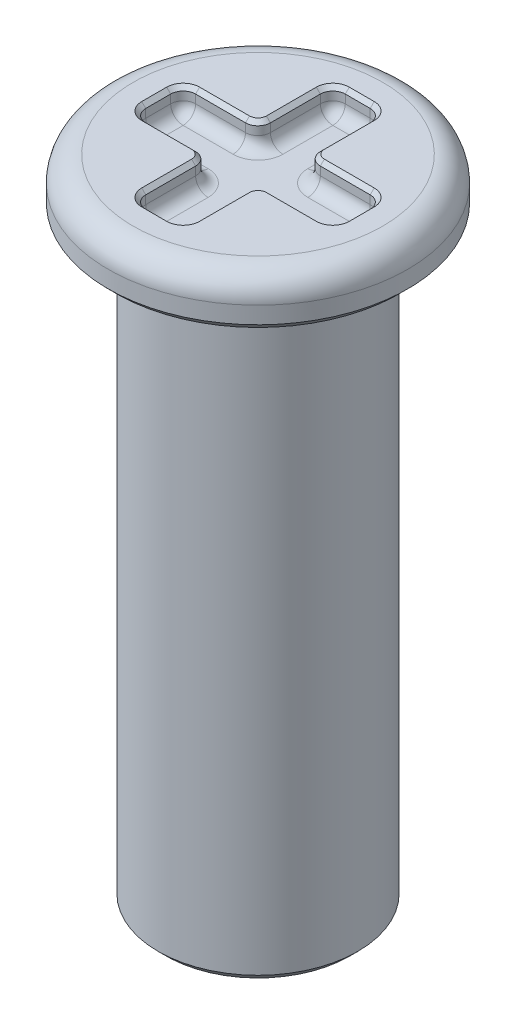
from build123d import *

# Parameters (mm, degrees)
CUT_EXTRUDE1_DEPTH = 0.79375
FILLET1_R          = 0.79375
FILLET2_R          = 0.396875
CHAMFER1_SIZE      = 0.254
CHAMFER2_SIZE      = 0.127


with BuildPart() as part:
    # Sketch1 → Revolve1 (revolve)
    with BuildSketch(Plane.XY):
        Polygon((2.38125, 0), (3.175, 0), (3.175, 19.05), (4.7625, 19.05), (4.7625, 20.6375), (0, 20.6375), (0, 19.05), (2.38125, 19.05), align=None)
    revolve(axis=Axis((0, 3.655427632, 0), (0, -1, 0)))

    # Sketch2 → Cut-Extrude1 (cut)
    with BuildSketch(Plane(origin=(0, 20.6375, 0), x_dir=(1, 0, 0), z_dir=(0, 1, 0))):
        Polygon((-3.175, 0.79375), (-3.175, -0.79375), (-0.79375, -0.79375), (-0.79375, -3.175), (0.79375, -3.175), (0.79375, -0.79375), (3.175, -0.79375), (3.175, 0.79375), (0.79375, 0.79375), (0.79375, 3.175), (-0.79375, 3.175), (-0.79375, 0.79375), align=None)
    extrude(amount=-CUT_EXTRUDE1_DEPTH, mode=Mode.SUBTRACT)

    # Fillet1
    fillet1_edges = [part.edges().sort_by_distance(p)[0] for p in [
        (-3.175, 19.05, 0),
        (-4.7625, 20.6375, 0),
    ]]
    fillet(fillet1_edges, radius=FILLET1_R)

    # Fillet2
    fillet2_edges = [part.edges().sort_by_distance(p)[0] for p in [
        (0, 19.84375, -3.175),
        (-0.79375, 19.84375, -1.984375),
        (-3.175, 19.84375, 0),
        (-1.984375, 19.84375, 0.79375),
        (-0.79375, 19.84375, 1.984375),
        (0, 19.84375, 3.175),
        (0.79375, 19.84375, 1.984375),
        (1.984375, 19.84375, 0.79375),
        (3.175, 19.84375, 0),
        (1.984375, 19.84375, -0.79375),
        (0.79375, 19.84375, -1.984375),
        (-0.79375, 20.240625, -3.175),
        (-0.79375, 20.240625, -0.79375),
        (-3.175, 20.240625, -0.79375),
        (-3.175, 20.240625, 0.79375),
        (-0.79375, 20.240625, 0.79375),
        (-0.79375, 20.240625, 3.175),
        (0.79375, 20.240625, 3.175),
        (0.79375, 20.240625, 0.79375),
        (3.175, 20.240625, 0.79375),
        (3.175, 20.240625, -0.79375),
        (0.79375, 20.240625, -0.79375),
        (0.79375, 20.240625, -3.175),
        (-1.984375, 19.84375, -0.79375),
        (-2.38125, 19.05, 0),
    ]]
    fillet(fillet2_edges, radius=FILLET2_R)

    # Chamfer1
    chamfer1_edges = [part.edges().sort_by_distance(p)[0] for p in [
        (-2.38125, 0, 0),
        (-3.175, 0, 0),
        (-4.7625, 19.05, 0),
    ]]
    chamfer(chamfer1_edges, length=CHAMFER1_SIZE)

    # Chamfer2
    chamfer2_edges = [part.edges().sort_by_distance(p)[0] for p in [
        (-1.984375, 20.6375, -0.79375),
        (-3.058758004, 20.6375, -0.677508004),
        (-0.909991996, 20.6375, -0.909991996),
        (-0.79375, 20.6375, -1.984375),
        (-0.677508004, 20.6375, -3.058758004),
        (-3.058758004, 20.6375, 0.677508004),
        (-1.984375, 20.6375, 0.79375),
        (-0.909991996, 20.6375, 0.909991996),
        (0.677508004, 20.6375, -3.058758004),
        (-0.79375, 20.6375, 1.984375),
        (0.79375, 20.6375, -1.984375),
        (-0.677508004, 20.6375, 3.058758004),
        (0.909991996, 20.6375, -0.909991996),
        (1.984375, 20.6375, -0.79375),
        (3.058758004, 20.6375, -0.677508004),
        (0.677508004, 20.6375, 3.058758004),
        (0.79375, 20.6375, 1.984375),
        (0.909991996, 20.6375, 0.909991996),
        (3.058758004, 20.6375, 0.677508004),
        (1.984375, 20.6375, 0.79375),
        (-3.175, 20.6375, 0),
        (0, 20.6375, -3.175),
        (0, 20.6375, 3.175),
        (3.175, 20.6375, 0),
    ]]
    chamfer(chamfer2_edges, length=CHAMFER2_SIZE)


solid = part.part
